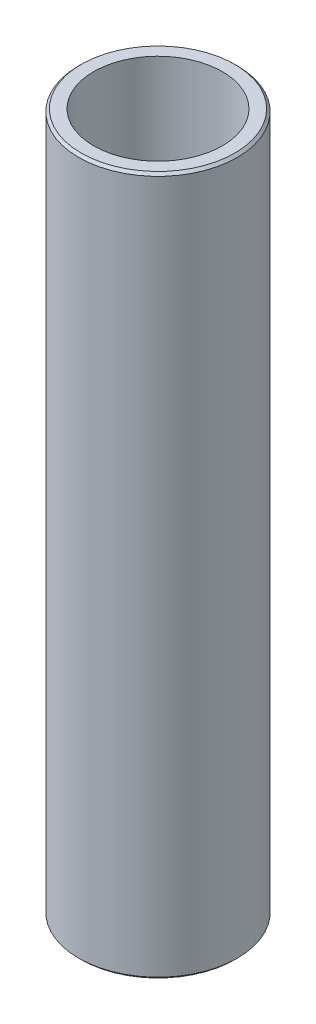
from build123d import *

# Parameters (mm, degrees)
SKETCH1_R           = 7.94
SKETCH1_R_2         = 6.44
BOSS_EXTRUDE1_DEPTH = 69.91
CHAMFER1_SIZE       = 0.25


with BuildPart() as part:
    # Sketch1 → Boss-Extrude1 (new body)
    with BuildSketch(Plane(origin=(0, 0, 0), x_dir=(1, 0, 0), z_dir=(0, 1, 0))):
        Circle(SKETCH1_R)
        Circle(SKETCH1_R_2, mode=Mode.SUBTRACT)
    extrude(amount=BOSS_EXTRUDE1_DEPTH)

    # Chamfer1
    chamfer1_edges = [part.edges().sort_by_distance(p)[0] for p in [
        (-7.94, 0, 0),
        (-7.94, 69.91, 0),
    ]]
    chamfer(chamfer1_edges, length=CHAMFER1_SIZE)


solid = part.part
